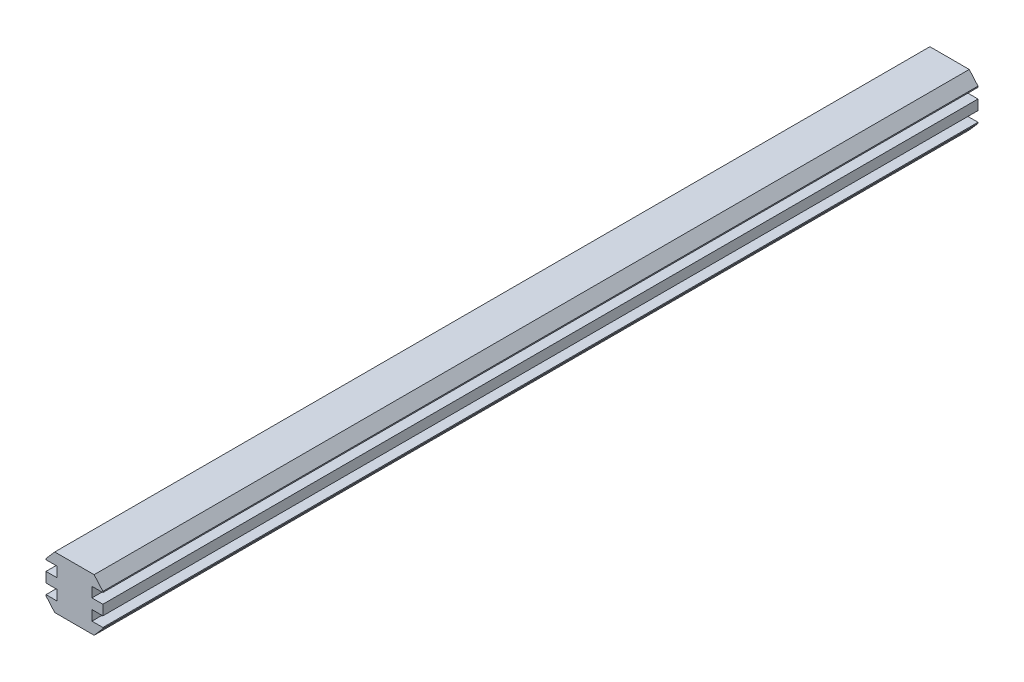
from build123d import *

# Parameters (mm, degrees)
RESSALTO_EXTRUS_O1_DEPTH = 200


with BuildPart() as part:
    # Esboço1 → Ressalto-extrusão1 (new body)
    with BuildSketch(Plane.XY):
        Polygon((-4.5, -6), (4.5, -6), (6.5, -3.7), (6.5, -3.45), (4, -3.45), (4, -1.15), (6.5, -1.15), (6.5, 1.15), (4, 1.15), (4, 3.45), (6.5, 3.45), (6.5, 3.7), (4.5, 6), (-4.5, 6), (-6.5, 3.7), (-6.5, 3.45), (-4, 3.45), (-4, 1.15), (-6.5, 1.15), (-6.5, -1.15), (-4, -1.15), (-4, -3.45), (-6.5, -3.45), (-6.5, -3.7), align=None)
    extrude(amount=RESSALTO_EXTRUS_O1_DEPTH)


solid = part.part
